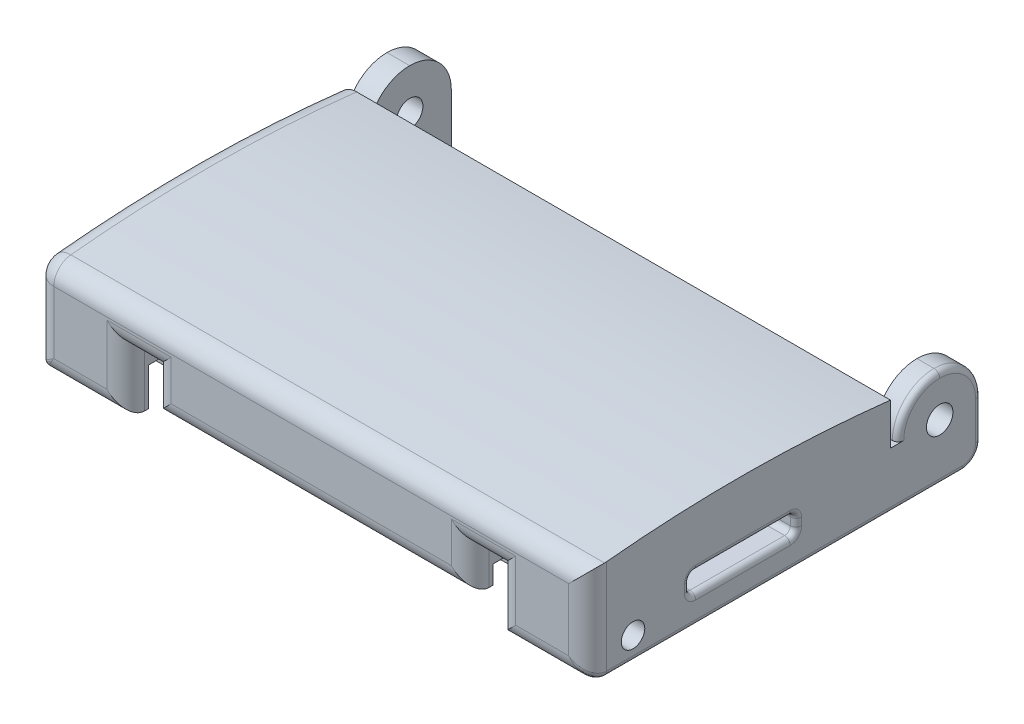
from build123d import *

# Parameters (mm, degrees)
SKETCH1_W            = 18.542
SKETCH1_H            = 10.16
EXTRUDE1_DEPTH       = 3.302
EXTRUDE2_DEPTH       = 18.542
EXTRUDE3_DEPTH       = 2.286
EXTRUDE4_DEPTH       = 1.27
SKETCH5_R            = 0.3937
EXTRUDE5_DEPTH       = 20.193
CHAMFER1_SIZE        = 0.762
SKETCH6_W            = 2.794
SKETCH6_H            = 4.064
EXTRUDE6_DEPTH       = 2.54
SKETCH7_W            = 3.556
SKETCH7_H            = 0.635
EXTRUDE7_DEPTH       = 11.43
EXTRUDE8_DEPTH       = 2.54
FILLET1_R            = 0.1905
SKETCH9_W            = 0.7112
SKETCH9_H            = 1.905
EXTRUDE9_DEPTH       = 0.254
SKETCH10_W           = 0.762
SKETCH10_H           = 3.302
EXTRUDE10_DEPTH      = 2.794
FILLET2_R            = 1.397
SKETCH11_R           = 0.4445
EXTRUDE11_DEPTH      = 24.04663325
FILLET2_OF_MIRROR1_R = 1.397
FILLET3_R            = 0.635
FILLET4_R            = 0.1905


# Some blends are built 0.0001 mm under size
with BuildPart() as part:
    # Sketch1 → Extrude1 (new body)
    with BuildSketch(Plane(origin=(0, 0, 0), x_dir=(1, 0, 0), z_dir=(0, 1, 0))):
        with Locations((9.271, 5.08)):
            Rectangle(SKETCH1_W, SKETCH1_H)
    extrude(amount=EXTRUDE1_DEPTH)

    # Sketch2 → Extrude2 (add)
    with BuildSketch(Plane(origin=(18.542, 0, 0), x_dir=(0, 0, -1), z_dir=(1, 0, 0))):
        with BuildLine():
            Line((0, 3.302), (0, 2.577061496))
            Line((0, 2.577061496), (10.16, 2.577061496))
            Line((10.16, 2.577061496), (10.16, 3.302))
            ThreePointArc((10.16, 3.302), (5.08, 3.590303072), (0, 3.302))
        make_face()
    extrude(amount=-EXTRUDE2_DEPTH)

    # Sketch3 → Extrude3 (cut)
    with BuildSketch(Plane.XY):
        Polygon((15.494, 2.007560649), (15.494, 0), (3.048, 0), (3.048, 2.007560649), (3.937, 2.007560649), (3.937, 0.653363326), (14.605, 0.653363326), (14.605, 2.007560649), align=None)
    extrude(amount=-EXTRUDE3_DEPTH, mode=Mode.SUBTRACT)

    # Sketch4 → Extrude4 (cut)
    with BuildSketch(Plane.XZ):
        Polygon((0.762, -2.286), (3.048, -2.286), (3.048, -3.129048767), (3.937, -3.129048767), (3.937, -2.286), (14.605, -2.286), (14.605, -3.129048767), (15.494, -3.129048767), (15.494, -2.286), (17.78, -2.286), (17.78, -0.762), (0.762, -0.762), align=None)
    extrude(amount=-EXTRUDE4_DEPTH, mode=Mode.SUBTRACT)

    # Sketch5 → Extrude5 (cut, symmetric)
    with BuildSketch(Plane(origin=(0.762, 0, 0), x_dir=(0, 0, -1), z_dir=(1, 0, 0))):
        with Locations((1.524, 0.790749557)):
            Circle(SKETCH5_R)
    extrude(amount=EXTRUDE5_DEPTH, both=True, mode=Mode.SUBTRACT)

    # Chamfer1
    # the kernel refuses this chamfer: 0.762 mm, written as the material it takes off along each edge
    with BuildSketch(Plane(origin=(3.937, 1.27, -2.286), x_dir=(0, 0.9996219169112966, 0.027495876610586157), z_dir=(-1, 0, 0))) as chamfer1_piece_1_section:
        Polygon((CHAMFER1_SIZE * 0.999621916911, CHAMFER1_SIZE * 0.0274958766106), (-CHAMFER1_SIZE * 0.0274958766106, CHAMFER1_SIZE * 0.999621916911), (0, 0), align=None)
    chamfer1_piece_1 = extrude(amount=0.889, mode=Mode.PRIVATE)
    chamfer1_piece_1 = split(chamfer1_piece_1, bisect_by=Plane(origin=(3.4925, 2.007560649, -2.538701503), z_dir=(0, -1, 0)), keep=Keep.TOP, mode=Mode.PRIVATE)
    add(chamfer1_piece_1, mode=Mode.SUBTRACT)
    with BuildSketch(Plane(origin=(15.494, 1.27, -2.286), x_dir=(0, 0.9996219169112966, 0.027495876610586157), z_dir=(-1, 0, 0))) as chamfer1_piece_2_section:
        Polygon((CHAMFER1_SIZE * 0.999621916911, CHAMFER1_SIZE * 0.0274958766106), (-CHAMFER1_SIZE * 0.0274958766106, CHAMFER1_SIZE * 0.999621916911), (0, 0), align=None)
    chamfer1_piece_2 = extrude(amount=0.889, mode=Mode.PRIVATE)
    chamfer1_piece_2 = split(chamfer1_piece_2, bisect_by=Plane(origin=(15.0495, 2.007560649, -2.538701503), z_dir=(0, -1, 0)), keep=Keep.TOP, mode=Mode.PRIVATE)
    add(chamfer1_piece_2, mode=Mode.SUBTRACT)

    # Sketch6 → Extrude6 (cut)
    with BuildSketch(Plane.XZ):
        with Locations((9.271, -5.211713378)):
            Rectangle(SKETCH6_W, SKETCH6_H)
    extrude(amount=-EXTRUDE6_DEPTH, mode=Mode.SUBTRACT)

    # Sketch7 → Extrude7 (cut, symmetric)
    with BuildSketch(Plane.ZY.offset(-10.668)):
        with Locations((-5.211713378, 1.27)):
            Rectangle(SKETCH7_W, SKETCH7_H)
    extrude(amount=EXTRUDE7_DEPTH, both=True, mode=Mode.SUBTRACT)

    # Sketch8 → Extrude8 (cut)
    with BuildSketch(Plane.XZ):
        with BuildLine():
            Line((7.874, -3.179713378), (7.874, -4.098967757))
            Line((7.874, -4.098967757), (7.874, -7.243713378))
            ThreePointArc((7.874, -7.243713378), (9.271, -7.497713378), (10.668, -7.243713378))
            Line((10.668, -7.243713378), (10.668, -3.179713378))
            ThreePointArc((10.668, -3.179713378), (9.271, -2.925713378), (7.874, -3.179713378))
        make_face()
    extrude(amount=-EXTRUDE8_DEPTH, mode=Mode.SUBTRACT)

    # Fillet1
    fillet1_edges = [part.edges().sort_by_distance(p)[0] for p in [
        (10.668, 1.5875, -5.211713378),
        (10.668, 1.27, -6.989713378),
        (10.668, 0.9525, -5.211713378),
        (10.668, 1.27, -3.433713378),
        (3.937, 1.5875, -3.433713378),
        (0, 1.27, -3.433713378),
        (7.874, 1.27, -3.433713378),
        (18.542, 1.27, -3.433713378),
        (14.605, 1.5875, -3.433713378),
        (3.937, 0.9525, -3.433713378),
        (0, 0.9525, -5.211713378),
        (7.874, 0.9525, -5.211713378),
        (18.542, 0.9525, -5.211713378),
        (14.605, 0.9525, -3.433713378),
        (3.937, 0.9525, -6.989713378),
        (0, 1.27, -6.989713378),
        (7.874, 1.27, -6.989713378),
        (18.542, 1.27, -6.989713378),
        (14.605, 0.9525, -6.989713378),
        (3.937, 1.5875, -6.989713378),
        (0, 1.5875, -5.211713378),
        (7.874, 1.5875, -5.211713378),
        (18.542, 1.5875, -5.211713378),
        (14.605, 1.5875, -6.989713378),
    ]]
    fillet(fillet1_edges, radius=FILLET1_R)

    # Sketch9 → Extrude9 (add)
    with BuildSketch(Plane(origin=(0, 0, -10.16), x_dir=(-1, 0, 0), z_dir=(0, 0, -1))):
        with Locations((-18.1864, 0.9525)):
            Rectangle(SKETCH9_W, SKETCH9_H)
    extrude9 = extrude(amount=EXTRUDE9_DEPTH)

    # Sketch10 → Extrude10 (add)
    with BuildSketch(Plane(origin=(0, 0, -10.414), x_dir=(-1, 0, 0), z_dir=(0, 0, -1))):
        with Locations((-18.161, 1.651)):
            Rectangle(SKETCH10_W, SKETCH10_H)
    extrude10 = extrude(amount=EXTRUDE10_DEPTH)

    # Fillet2
    fillet2_edges = [part.edges().sort_by_distance(p)[0] for p in [
        (18.161, 3.302, -10.414),
        (18.161, 3.302, -13.208),
    ]]
    fillet(fillet2_edges, radius=FILLET2_R - 0.0001)  # a hair under: the kernel refuses the full size

    # Sketch11 → Extrude11 (cut, through all)
    with BuildSketch(Plane(origin=(18.542, 0, 0), x_dir=(0, 0, -1), z_dir=(1, 0, 0))):
        with Locations((11.811, 1.905)):
            Circle(SKETCH11_R)
    extrude11 = extrude(amount=-EXTRUDE11_DEPTH, mode=Mode.SUBTRACT)

    # Mirror1: Extrude9, Extrude10, Extrude11 across plane
    add(extrude9.mirror(Plane.ZY.offset(-9.271)))
    add(extrude10.mirror(Plane.ZY.offset(-9.271)))
    add(extrude11.mirror(Plane.ZY.offset(-9.271)), mode=Mode.SUBTRACT)

    # Fillet2 of Mirror1
    fillet2_of_mirror1_edges = [part.edges().sort_by_distance(p)[0] for p in [
        (0.381, 3.302, -10.414),
        (0.381, 3.302, -13.208),
    ]]
    fillet(fillet2_of_mirror1_edges, radius=FILLET2_OF_MIRROR1_R - 0.0001)  # a hair under: the kernel refuses the full size

    # Fillet3
    fillet3_edges = [part.edges().sort_by_distance(p)[0] for p in [
        (0, 3.590303072, -5.08),
        (0, 1.651, 0),
        (9.271, 3.302, 0),
        (18.542, 1.651, 0),
        (17.018, 0, 0),
        (1.524, 0, 0),
        (9.271, 0, -10.16),
        (18.161, 0, -13.208),
        (14.605, 1.330461987, 0),
        (9.271, 0.653363326, 0),
        (3.937, 1.330461987, 0),
        (3.4925, 2.007560649, 0),
        (3.048, 1.003780325, 0),
        (15.494, 1.003780325, 0),
        (15.0495, 2.007560649, 0),
    ]]
    fillet(fillet3_edges, radius=FILLET3_R)

    # Fillet4
    fillet4_edges = [part.edges().sort_by_distance(p)[0] for p in [
        (18.542, 1.27005, -13.208),
        (18.542, 2.892857463, -12.798857463),
        (18.542, 2.892857463, -10.823142537),
        (18.542, 0, -6.604),
        (18.542, 0.185987194, -13.022012806),
        (0.224758944, 0.224758944, -0.150307029),
        (18.317241056, 0.224758944, -0.150307029),
        (0, 0, -6.9215),
    ]]
    fillet(fillet4_edges, radius=FILLET4_R)


solid = part.part
